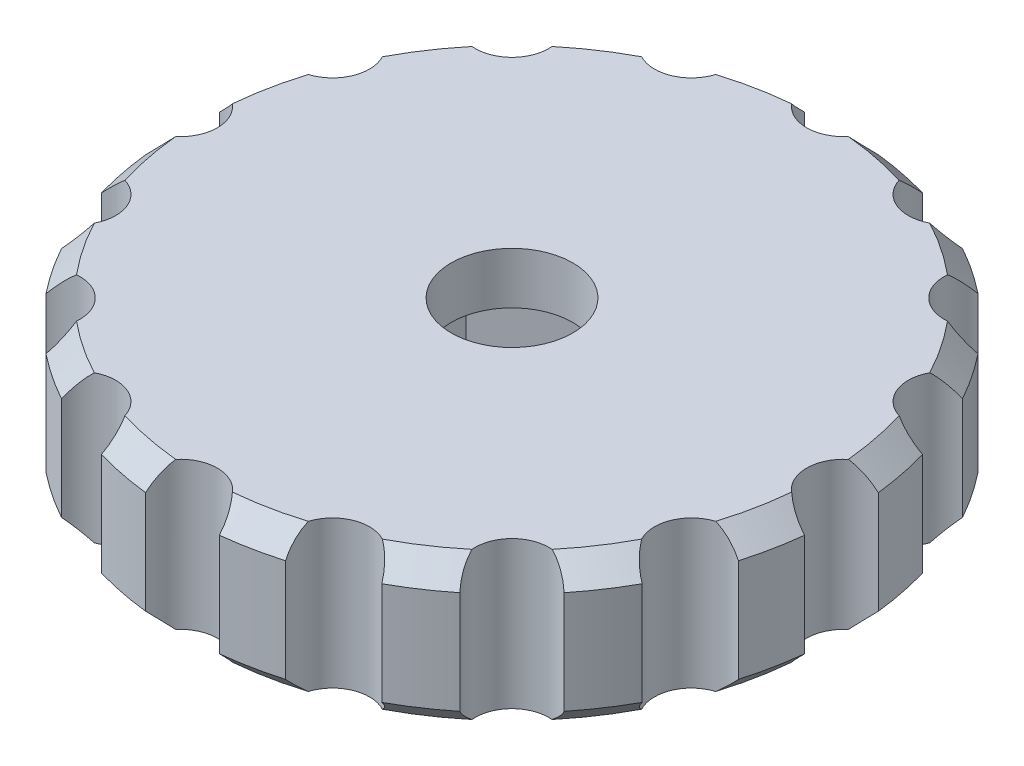
from build123d import *

# Parameters (mm, degrees)
SKETCH1_R           = 9
BOSS_EXTRUDE1_DEPTH = 4
CUT_EXTRUDE1_DEPTH  = 2.6
SKETCH3_R           = 1.65
CUT_EXTRUDE2_DEPTH  = 14.341664064
CUT_EXTRUDE4_DEPTH  = 14.341664064


with BuildPart() as part:
    # Sketch1 → Boss-Extrude1 (new body)
    with BuildSketch(Plane(origin=(0, 0, 0), x_dir=(1, 0, 0), z_dir=(0, 1, 0))):
        Circle(SKETCH1_R)
    extrude(amount=BOSS_EXTRUDE1_DEPTH)

    # Sketch2 → Cut-Extrude1 (cut)
    with BuildSketch(Plane.XZ):
        Polygon((2.95, 1.703183294), (0, 3.406366588), (-2.95, 1.703183294), (-2.95, -1.703183294), (0, -3.406366588), (2.95, -1.703183294), align=None)
    extrude(amount=-CUT_EXTRUDE1_DEPTH, mode=Mode.SUBTRACT)

    # Sketch3 → Cut-Extrude2 (cut, through all)
    with BuildSketch(Plane.XZ):
        Circle(SKETCH3_R)
    extrude(amount=-CUT_EXTRUDE2_DEPTH, mode=Mode.SUBTRACT)

    # Sketch4 → Cut-Extrude4 (cut, through all)
    with BuildSketch(Plane(origin=(0, 4, 0), x_dir=(1, 0, 0), z_dir=(0, 1, 0))):
        with BuildLine():
            ThreePointArc((-1, 8.94427191), (0, 7.998448394), (1, 8.94427191))
            ThreePointArc((1, 8.94427191), (0, 9), (-1, 8.94427191))
        make_face()
        with BuildLine():
            ThreePointArc((2.498945142, 8.646113183), (3.060873685, 7.389602763), (4.346704207, 7.880746318))
            ThreePointArc((4.346704207, 7.880746318), (3.444150891, 8.314915793), (2.498945142, 8.646113183))
        make_face()
        with BuildLine():
            ThreePointArc((5.617448539, 7.031662102), (5.655757098, 5.655757098), (7.031662102, 5.617448539))
            ThreePointArc((7.031662102, 5.617448539), (6.363961031, 6.363961031), (5.617448539, 7.031662102))
        make_face()
        with BuildLine():
            ThreePointArc((7.880746318, 4.346704207), (7.389602763, 3.060873685), (8.646113183, 2.498945142))
            ThreePointArc((8.646113183, 2.498945142), (8.314915793, 3.444150891), (7.880746318, 4.346704207))
        make_face()
        with BuildLine():
            ThreePointArc((8.94427191, 1), (7.998448394, 0), (8.94427191, -1))
            ThreePointArc((8.94427191, -1), (9, 0), (8.94427191, 1))
        make_face()
        with BuildLine():
            ThreePointArc((8.646113183, -2.498945142), (7.389602763, -3.060873685), (7.880746318, -4.346704207))
            ThreePointArc((7.880746318, -4.346704207), (8.314915793, -3.444150891), (8.646113183, -2.498945142))
        make_face()
        with BuildLine():
            ThreePointArc((7.031662102, -5.617448539), (5.655757098, -5.655757098), (5.617448539, -7.031662102))
            ThreePointArc((5.617448539, -7.031662102), (6.363961031, -6.363961031), (7.031662102, -5.617448539))
        make_face()
        with BuildLine():
            ThreePointArc((4.346704207, -7.880746318), (3.060873685, -7.389602763), (2.498945142, -8.646113183))
            ThreePointArc((2.498945142, -8.646113183), (3.444150891, -8.314915793), (4.346704207, -7.880746318))
        make_face()
        with BuildLine():
            ThreePointArc((1, -8.94427191), (0, -7.998448394), (-1, -8.94427191))
            ThreePointArc((-1, -8.94427191), (0, -9), (1, -8.94427191))
        make_face()
        with BuildLine():
            ThreePointArc((-2.498945142, -8.646113183), (-3.060873685, -7.389602763), (-4.346704207, -7.880746318))
            ThreePointArc((-4.346704207, -7.880746318), (-3.444150891, -8.314915793), (-2.498945142, -8.646113183))
        make_face()
        with BuildLine():
            ThreePointArc((-5.617448539, -7.031662102), (-5.655757098, -5.655757098), (-7.031662102, -5.617448539))
            ThreePointArc((-7.031662102, -5.617448539), (-6.363961031, -6.363961031), (-5.617448539, -7.031662102))
        make_face()
        with BuildLine():
            ThreePointArc((-7.880746318, -4.346704207), (-7.389602763, -3.060873685), (-8.646113183, -2.498945142))
            ThreePointArc((-8.646113183, -2.498945142), (-8.314915793, -3.444150891), (-7.880746318, -4.346704207))
        make_face()
        with BuildLine():
            ThreePointArc((-8.94427191, -1), (-7.998448394, 0), (-8.94427191, 1))
            ThreePointArc((-8.94427191, 1), (-9, 0), (-8.94427191, -1))
        make_face()
        with BuildLine():
            ThreePointArc((-8.646113183, 2.498945142), (-7.389602763, 3.060873685), (-7.880746318, 4.346704207))
            ThreePointArc((-7.880746318, 4.346704207), (-8.314915793, 3.444150891), (-8.646113183, 2.498945142))
        make_face()
        with BuildLine():
            ThreePointArc((-7.031662102, 5.617448539), (-5.655757098, 5.655757098), (-5.617448539, 7.031662102))
            ThreePointArc((-5.617448539, 7.031662102), (-6.363961031, 6.363961031), (-7.031662102, 5.617448539))
        make_face()
        with BuildLine():
            ThreePointArc((-4.346704207, 7.880746318), (-3.060873685, 7.389602763), (-2.498945142, 8.646113183))
            ThreePointArc((-2.498945142, 8.646113183), (-3.444150891, 8.314915793), (-4.346704207, 7.880746318))
        make_face()
    extrude(amount=-CUT_EXTRUDE4_DEPTH, mode=Mode.SUBTRACT)

    # Sketch5 → Cut-Revolve1 (revolve, cut)
    with BuildSketch(Plane.XY):
        Polygon((8.29427191, 4.1), (9.04427191, 3.35), (9.04427191, 4.1), align=None)
        Polygon((9.04427191, -0.1), (8.29427191, -0.1), (9.04427191, 0.65), align=None)
    revolve(axis=Axis((0, 0, 0), (0, 1, 0)), mode=Mode.SUBTRACT)


solid = part.part
